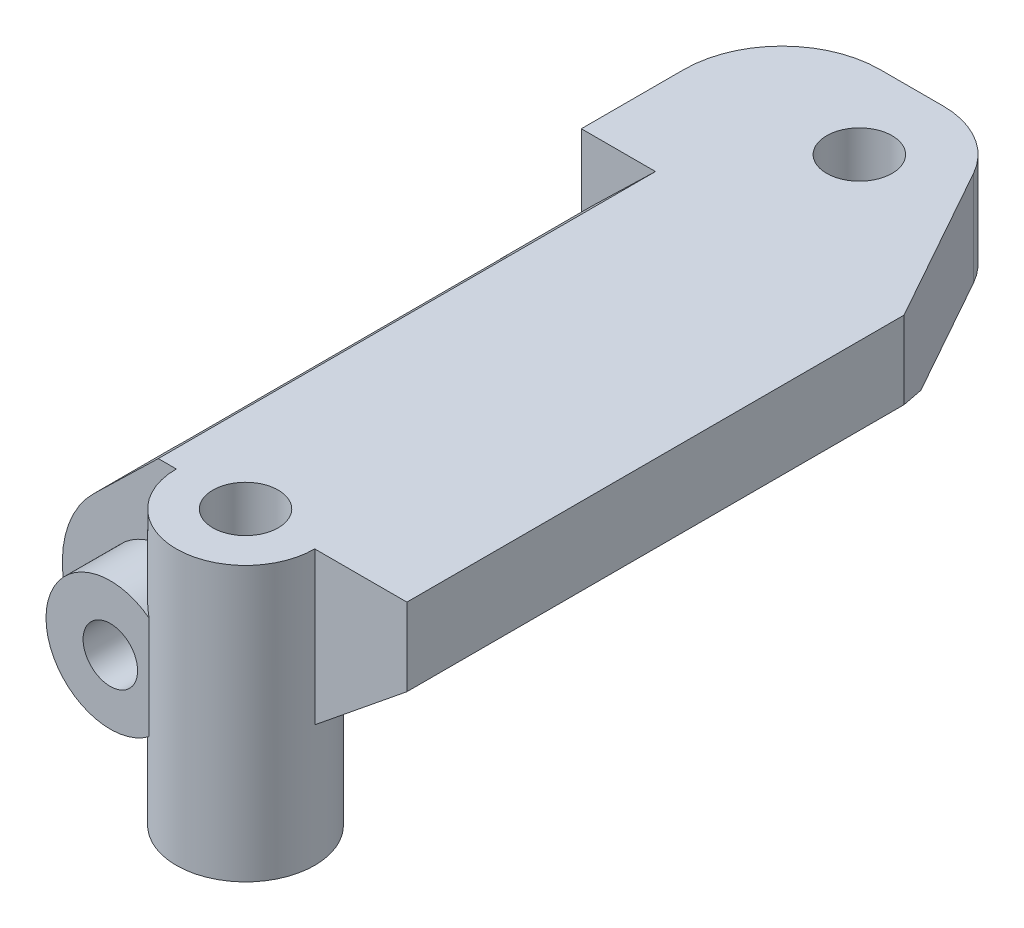
from build123d import *

# Parameters (mm, degrees)
BOSS_EXTRUDE1_DEPTH = 4.35
BOSS_EXTRUDE2_DEPTH = 22.8
CUT_EXTRUDE1_DEPTH  = 35.228241264
BOSS_EXTRUDE3_START = -12.57
SKETCH5_R           = 3.175
BOSS_EXTRUDE3_DEPTH = 12.57
SKETCH6_R           = 2.95
BOSS_EXTRUDE4_DEPTH = 2.6
CHAMFER1_SIZE       = 1.5
SKETCH7_R           = 1.5
CUT_EXTRUDE2_DEPTH  = 26.053852665
SKETCH8_R           = 1.25
CUT_EXTRUDE3_DEPTH  = 37.969425255
SKETCH9_W           = 15
SKETCH9_H           = 8.6
CUT_EXTRUDE4_DEPTH  = 25.4
CHAMFER2_SIZE       = 2.5
FILLET1_R           = 0.25


with BuildPart() as part:
    # Sketch2 → Boss-Extrude1 (new body)
    with BuildSketch(Plane(origin=(0, 0, 0), x_dir=(1, 0, 0), z_dir=(0, 1, 0))):
        with BuildLine():
            ThreePointArc((1.475, -16), (-1.7, -12.825), (-4.875, -16))
            Line((-4.875, -16), (1.475, -16))
        make_face()
        with BuildLine():
            Line((1.475, -16), (-4.875, -16))
            ThreePointArc((-4.875, -16), (-1.7, -19.175), (1.475, -16))
        make_face()
        with BuildLine():
            Line((-5.7, 15.863484846), (-5.7, 6.8))
            Line((-5.7, 6.8), (-5.7, -16))
            Line((-5.7, -16), (-4.875, -16))
            ThreePointArc((-4.875, -16), (-1.7, -12.825), (1.475, -16))
            Line((1.475, -16), (5.7, -16))
            Line((5.7, -16), (5.7, 6.8))
            Line((5.7, 6.8), (1.660846582, 14.02808686))
            ThreePointArc((1.660846582, 14.02808686), (0.248315373, 15.470627532), (-1.7, 16))
            Line((-1.7, 16), (-4.6, 16))
            ThreePointArc((-4.6, 16), (-5.154219358, 15.965740801), (-5.7, 15.863484846))
        make_face()
        with BuildLine():
            Line((-9.1, 6.8), (-5.7, 6.8))
            Line((-5.7, 6.8), (-5.7, 15.863484846))
            ThreePointArc((-5.7, 15.863484846), (-8.14964787, 14.265863337), (-9.1, 11.5))
            Line((-9.1, 11.5), (-9.1, 6.8))
        make_face()
    extrude(amount=BOSS_EXTRUDE1_DEPTH)

    # Sketch3 → Boss-Extrude2 (add)
    with BuildSketch(Plane.XY.offset(16)):
        with BuildLine():
            Line((5.7, 0.79), (-4.875, 4.092368421))
            Line((-4.875, 4.092368421), (-4.875, 2.831147875))
            ThreePointArc((-4.875, 2.831147875), (-1.758813758, 1.290370349), (-0.5, -1.95))
            ThreePointArc((-0.5, -1.95), (-0.966901247, -4.015007311), (-2.276772998, -5.678283585))
            Line((-2.276772998, -5.678283585), (5.7, 0.79))
        make_face()
        with BuildLine():
            ThreePointArc((-5.7, 2.833304297), (-7.287324911, 2.419272216), (-8.642534504, 1.494918444))
            ThreePointArc((-8.642534504, 1.494918444), (-8.890152665, -5.136032618), (-2.276772998, -5.678283585))
            ThreePointArc((-2.276772998, -5.678283585), (-0.966901247, -4.015007311), (-0.5, -1.95))
            ThreePointArc((-0.5, -1.95), (-1.758813758, 1.290370349), (-4.875, 2.831147875))
            Line((-4.875, 2.831147875), (-4.875, 0))
            Line((-4.875, 0), (-5.7, 0))
            Line((-5.7, 0), (-5.7, 2.833304297))
        make_face()
        with BuildLine():
            ThreePointArc((-4.875, 2.831147875), (-5.287453585, 2.849983603), (-5.7, 2.833304297))
            Line((-5.7, 2.833304297), (-5.7, 0))
            Line((-5.7, 0), (-4.875, 0))
            Line((-4.875, 0), (-4.875, 2.831147875))
        make_face()
        with BuildLine():
            Line((-4.875, 4.092368421), (-5.7, 4.35))
            Line((-5.7, 4.35), (-5.7, 2.833304297))
            ThreePointArc((-5.7, 2.833304297), (-5.287453585, 2.849983603), (-4.875, 2.831147875))
            Line((-4.875, 2.831147875), (-4.875, 4.092368421))
        make_face()
        with BuildLine():
            Line((-5.7, 2.833304297), (-5.7, 4.35))
            Line((-5.7, 4.35), (-8.642534504, 1.494918444))
            ThreePointArc((-8.642534504, 1.494918444), (-7.287324911, 2.419272216), (-5.7, 2.833304297))
        make_face()
    extrude(amount=-BOSS_EXTRUDE2_DEPTH)

    # Sketch4 → Cut-Extrude1 (cut, through all)
    with BuildSketch(Plane.XY.offset(16)):
        Polygon((5.7, 0), (5.7, 0.79), (4.725761535, 0), align=None)
    extrude(amount=-CUT_EXTRUDE1_DEPTH, mode=Mode.SUBTRACT)

    # Sketch5 → Boss-Extrude3 (add)
    with BuildSketch(Plane(origin=(0, 4.35, 0), x_dir=(1, 0, 0), z_dir=(0, 1, 0)).offset(BOSS_EXTRUDE3_START)):
        with Locations(Location((-1.7, -16, 0), (0, 0, 100.46651796))):
            Circle(SKETCH5_R)
    extrude(amount=BOSS_EXTRUDE3_DEPTH)

    # Sketch6 → Boss-Extrude4 (add)
    with BuildSketch(Plane.XY.offset(16)):
        with Locations((-5.3, -1.95)):
            Circle(SKETCH6_R)
    extrude(amount=BOSS_EXTRUDE4_DEPTH)

    # Chamfer1
    # the kernel refuses this chamfer: 1.5 mm, written as the material it takes off along each edge
    with BuildSketch(Plane(origin=(-5.273011582, -8.107902789, -6.8), x_dir=(0.017317974295388713, -0.021356755298707605, 0.9996219169112968), z_dir=(0.7767257469610731, 0.6298389587884852, 0))) as chamfer1_piece_1_section:
        Polygon((CHAMFER1_SIZE * 0.999621916911, -CHAMFER1_SIZE * 0.0274958766106), (-CHAMFER1_SIZE * 0.0274958766106, -CHAMFER1_SIZE * 0.999621916911), (0, 0), align=None)
    chamfer1_piece_1 = extrude(amount=16.730502051, mode=Mode.PRIVATE)
    chamfer1_piece_1 = split(chamfer1_piece_1, bisect_by=Plane(origin=(-2.677352376, 0, -6.368001428), z_dir=(0, -1, 0)), keep=Keep.TOP, mode=Mode.PRIVATE)
    add(chamfer1_piece_1, mode=Mode.SUBTRACT)

    # Sketch7 → Cut-Extrude2 (cut, through all)
    with BuildSketch(Plane(origin=(0, 4.35, 0), x_dir=(1, 0, 0), z_dir=(0, 1, 0))):
        with Locations(Location((-1.7, 12.15, 0), (0, 0, 270))):
            Circle(SKETCH7_R)
        with Locations(Location((-1.7, -16, 0), (0, 0, 270))):
            Circle(SKETCH7_R)
    extrude(amount=-CUT_EXTRUDE2_DEPTH, mode=Mode.SUBTRACT)

    # Sketch8 → Cut-Extrude3 (cut, through all)
    with BuildSketch(Plane.XY.offset(18.6)):
        with Locations((-5.3, -1.95)):
            Circle(SKETCH8_R)
    extrude(amount=-CUT_EXTRUDE3_DEPTH, mode=Mode.SUBTRACT)

    # Sketch9 → Cut-Extrude4 (cut)
    with BuildSketch(Plane(origin=(3.7, 0, 0), x_dir=(0, 0, -1), z_dir=(1, 0, 0))):
        with Locations((-4.814141793, -2.45)):
            Rectangle(SKETCH9_W, SKETCH9_H)
    extrude(amount=-CUT_EXTRUDE4_DEPTH, mode=Mode.SUBTRACT)

    # Chamfer2
    chamfer2_edges = [part.edges().sort_by_distance(p)[0] for p in [
        (3.7, 1.85, 4.814141793),
    ]]
    chamfer(chamfer2_edges, length=CHAMFER2_SIZE)

    # Fillet1
    # the kernel refuses this fillet: 0.25 mm, written as the material it takes off along each edge
    with BuildSketch(Plane(origin=(3.7, -0.831779531, 12.314141793), x_dir=(0, 1, 0), z_dir=(0, 0, -1))) as fillet1_piece_1:
        with BuildLine():
            CenterArc((0.408056999, 0.106294437), FILLET1_R, 140.961757793, 64.20015701)
            Line((0.213875562, 0.263754177), (0, 0))
            Line((0, 0), (0.181779531, 0))
        make_face()
    extrude(amount=15, mode=Mode.SUBTRACT)


solid = part.part
